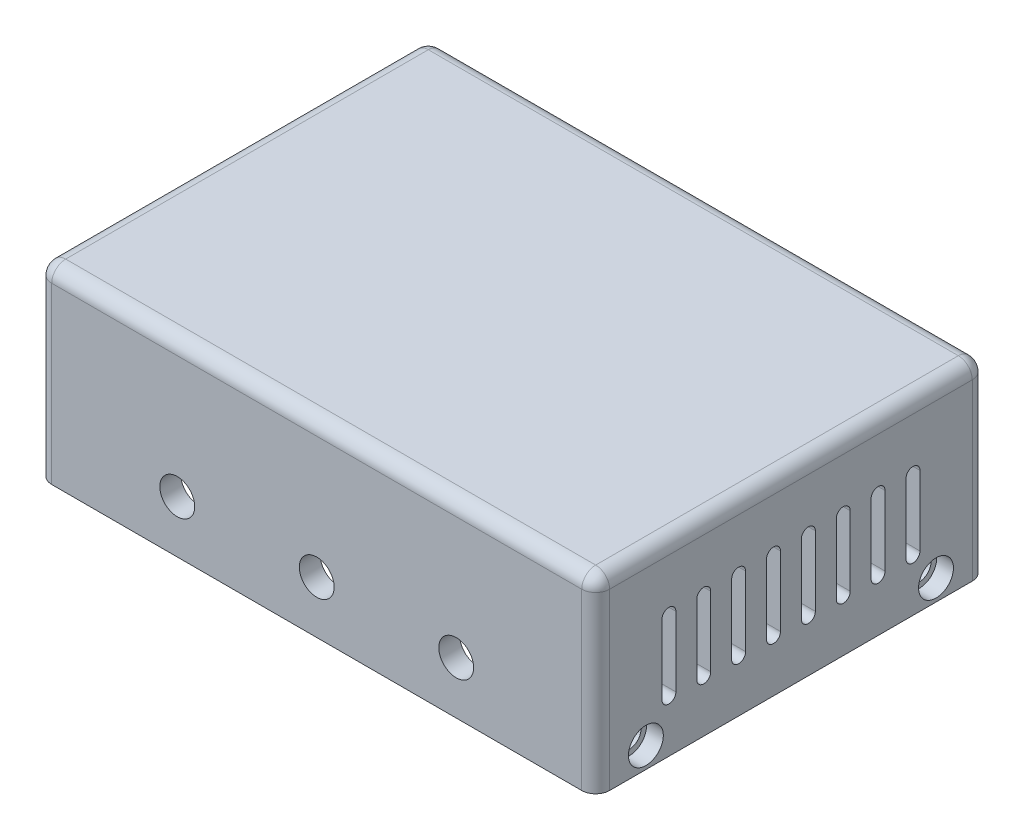
from build123d import *

# Parameters (mm, degrees)
SKETCH1_W                                    = 80
SKETCH1_H                                    = 56
BOSS_EXTRUDE1_DEPTH                          = 3
SKETCH2_W                                    = 74
SKETCH2_H                                    = 50
BOSS_EXTRUDE2_DEPTH                          = 24
FILLET1_R                                    = 1
FILLET2_R                                    = 2
SKETCH3_R                                    = 2.5
CUT_EXTRUDE1_DEPTH                           = 10
CUT_EXTRUDE2_DEPTH                           = 10
FILLET3_R                                    = 2
BOSS_EXTRUDE3_DEPTH                          = 2
CUT_EXTRUDE3_DEPTH                           = 89.090862182
CBORE_FOR_M3_CROSS_RECESS_PAN_HEAD_S_2_COUNT = 2
CBORE_FOR_M3_CROSS_RECESS_PAN_HEAD_S_2_PITCH = 15.207328374
CBORE_FOR_M3_CROSS_RECESS_PAN_HEAD_S_3_COUNT = 2
CBORE_FOR_M3_CROSS_RECESS_PAN_HEAD_S_3_PITCH = 14.900401376


with BuildPart() as part:
    # Sketch1 → Boss-Extrude1 (new body)
    with BuildSketch(Plane(origin=(0, 0, 0), x_dir=(1, 0, 0), z_dir=(0, 1, 0))):
        Rectangle(SKETCH1_W, SKETCH1_H)
    extrude(amount=BOSS_EXTRUDE1_DEPTH)

    # Sketch2 → Boss-Extrude2 (add)
    with BuildSketch(Plane.XZ):
        Polygon((37, -28), (-37, -28), (-40, -28), (-40, 28), (40, 28), (40, -28), align=None)
        Rectangle(SKETCH2_W, SKETCH2_H, mode=Mode.SUBTRACT)
    extrude(amount=BOSS_EXTRUDE2_DEPTH)

    # Fillet1
    fillet1_edges = [part.edges().sort_by_distance(p)[0] for p in [
        (-37, -12, -25),
        (37, -12, -25),
        (37, -12, 25),
        (-37, -12, 25),
    ]]
    fillet(fillet1_edges, radius=FILLET1_R)

    # Fillet2
    fillet2_edges = [part.edges().sort_by_distance(p)[0] for p in [
        (-40, 3, 0),
        (0, 3, 28),
        (40, 3, 0),
        (40, -10.5, 28),
        (-40, -10.5, 28),
        (-40, -10.5, -28),
        (40, -10.5, -28),
        (0, 3, -28),
    ]]
    fillet(fillet2_edges, radius=FILLET2_R)

    # Sketch3 → Cut-Extrude1 (cut)
    with BuildSketch(Plane.XY.offset(28)):
        with Locations((0, -16.5)):
            Circle(SKETCH3_R)
        with Locations((-20, -16.5)):
            Circle(SKETCH3_R)
        with Locations(Location((20, -16.5, 0), (0, 0, 180))):
            Circle(SKETCH3_R)
    extrude(amount=-CUT_EXTRUDE1_DEPTH, mode=Mode.SUBTRACT)

    # Sketch5 → Cut-Extrude2 (cut)
    with BuildSketch(Plane(origin=(0, 0, -28), x_dir=(-1, 0, 0), z_dir=(0, 0, -1))):
        with BuildLine():
            Line((-27, -1), (-23, -1))
            ThreePointArc((-23, -1), (-20, -4), (-23, -7))
            Line((-23, -7), (-27, -7))
            ThreePointArc((-27, -7), (-30, -4), (-27, -1))
        make_face()
    extrude(amount=-CUT_EXTRUDE2_DEPTH, mode=Mode.SUBTRACT)

    # Fillet3
    fillet3_edges = [part.edges().sort_by_distance(p)[0] for p in [
        (30, -4, -28),
        (25, -7, -28),
        (20, -4, -28),
        (25, -1, -28),
    ]]
    fillet(fillet3_edges, radius=FILLET3_R - 0.0001)  # a hair under: the kernel refuses the full size

    # Sketch6 → Boss-Extrude3 (add)
    with BuildSketch(Plane.XZ):
        with BuildLine():
            Line((37, 18.5), (33, 18.5))
            ThreePointArc((33, 18.5), (31.232233047, 19.232233047), (30.5, 21))
            Line((30.5, 21), (30.5, 25))
            Line((30.5, 25), (37, 25))
            Line((37, 25), (37, 18.5))
        make_face()
        with BuildLine():
            Line((37, -5), (30.5, -5))
            Line((30.5, -5), (30.5, -1))
            ThreePointArc((30.5, -1), (31.232233047, 0.767766953), (33, 1.5))
            Line((33, 1.5), (37, 1.5))
            Line((37, 1.5), (37, -5))
        make_face()
        with BuildLine():
            Line((-29, 1.5), (-25, 1.5))
            ThreePointArc((-25, 1.5), (-23.232233047, 0.767766953), (-22.5, -1))
            Line((-22.5, -1), (-22.5, -5))
            Line((-22.5, -5), (-29, -5))
            Line((-29, -5), (-29, 1.5))
        make_face()
        with BuildLine():
            Line((-29, 25), (-22.5, 25))
            Line((-22.5, 25), (-22.5, 21))
            ThreePointArc((-22.5, 21), (-23.232233047, 19.232233047), (-25, 18.5))
            Line((-25, 18.5), (-29, 18.5))
            Line((-29, 18.5), (-29, 25))
        make_face()
    extrude(amount=BOSS_EXTRUDE3_DEPTH)

    # Sketch7 → Cut-Extrude3 (cut, through all)
    with BuildSketch(Plane.ZY.offset(40)):
        with BuildLine():
            Line((-16.5, -6.5), (-16.5, -16.5))
            ThreePointArc((-16.5, -16.5), (-17.5, -17.5), (-18.5, -16.5))
            Line((-18.5, -16.5), (-18.5, -6.5))
            ThreePointArc((-18.5, -6.5), (-17.5, -5.5), (-16.5, -6.5))
        make_face()
        with BuildLine():
            Line((-11.5, -6.5), (-11.5, -16.5))
            ThreePointArc((-11.5, -16.5), (-12.5, -17.5), (-13.5, -16.5))
            Line((-13.5, -16.5), (-13.5, -6.5))
            ThreePointArc((-13.5, -6.5), (-12.5, -5.5), (-11.5, -6.5))
        make_face()
        with BuildLine():
            Line((-6.5, -6.5), (-6.5, -16.5))
            ThreePointArc((-6.5, -16.5), (-7.5, -17.5), (-8.5, -16.5))
            Line((-8.5, -16.5), (-8.5, -6.5))
            ThreePointArc((-8.5, -6.5), (-7.5, -5.5), (-6.5, -6.5))
        make_face()
        with BuildLine():
            Line((-1.5, -6.5), (-1.5, -16.5))
            ThreePointArc((-1.5, -16.5), (-2.5, -17.5), (-3.5, -16.5))
            Line((-3.5, -16.5), (-3.5, -6.5))
            ThreePointArc((-3.5, -6.5), (-2.5, -5.5), (-1.5, -6.5))
        make_face()
        with BuildLine():
            Line((3.5, -6.5), (3.5, -16.5))
            ThreePointArc((3.5, -16.5), (2.5, -17.5), (1.5, -16.5))
            Line((1.5, -16.5), (1.5, -6.5))
            ThreePointArc((1.5, -6.5), (2.5, -5.5), (3.5, -6.5))
        make_face()
        with BuildLine():
            Line((8.5, -6.5), (8.5, -16.5))
            ThreePointArc((8.5, -16.5), (7.5, -17.5), (6.5, -16.5))
            Line((6.5, -16.5), (6.5, -6.5))
            ThreePointArc((6.5, -6.5), (7.5, -5.5), (8.5, -6.5))
        make_face()
        with BuildLine():
            Line((13.5, -6.5), (13.5, -16.5))
            ThreePointArc((13.5, -16.5), (12.5, -17.5), (11.5, -16.5))
            Line((11.5, -16.5), (11.5, -6.5))
            ThreePointArc((11.5, -6.5), (12.5, -5.5), (13.5, -6.5))
        make_face()
        with BuildLine():
            Line((18.5, -6.5), (18.5, -16.5))
            ThreePointArc((18.5, -16.5), (17.5, -17.5), (16.5, -16.5))
            Line((16.5, -16.5), (16.5, -6.5))
            ThreePointArc((16.5, -6.5), (17.5, -5.5), (18.5, -6.5))
        make_face()
    extrude(amount=-CUT_EXTRUDE3_DEPTH, mode=Mode.SUBTRACT)

    # Sketch9 → CBORE for M3 Cross Recess Pan Head Screw1 (revolve, cut)
    with BuildSketch(Plane(origin=(40, -21, -20.8), x_dir=(0, 0, -1), z_dir=(0, 1, 0))):
        Polygon((0, 0), (0, 3), (1.7, 3), (1.7, 2.4), (2.5, 2.4), (2.5, 0), align=None)
    cbore_for_m3_cross_recess_pan_head_screw = revolve(axis=Axis((46.35, -21, -20.8), (-1, 0, 0)), mode=Mode.SUBTRACT)

    # CBORE for M3 Cross Recess Pan Head S 2: CBORE for M3 Cross Recess Pan Head Screw1 ×2
    with Locations(*[Vector(0, -0.1073379095741248, -0.9942225973936909) * (i * CBORE_FOR_M3_CROSS_RECESS_PAN_HEAD_S_2_PITCH) for i in range(1, CBORE_FOR_M3_CROSS_RECESS_PAN_HEAD_S_2_COUNT)]):
        add(cbore_for_m3_cross_recess_pan_head_screw, mode=Mode.SUBTRACT)

    # CBORE for M3 Cross Recess Pan Head S 3: CBORE for M3 Cross Recess Pan Head Screw1 ×2
    with Locations(*[Vector(0, -0.0825685481728506, -0.9965853876375209) * (i * CBORE_FOR_M3_CROSS_RECESS_PAN_HEAD_S_3_PITCH) for i in range(1, CBORE_FOR_M3_CROSS_RECESS_PAN_HEAD_S_3_COUNT)]):
        add(cbore_for_m3_cross_recess_pan_head_screw, mode=Mode.SUBTRACT)

    # Mirror1: CBORE for M3 Cross Recess Pan Head Screw1 across plane
    add(cbore_for_m3_cross_recess_pan_head_screw.mirror(Plane.XY), mode=Mode.SUBTRACT)

    # Mirror1 copy 1 sketch → Mirror1 copy 1 (revolve, cut)
    with BuildSketch(Plane(origin=(40, -22.632322838, 35.919469515), x_dir=(0, 0, 1), z_dir=(0, 1, 0))):
        Polygon((0, 0), (0, -3), (1.7, -3), (1.7, -2.4), (2.5, -2.4), (2.5, 0), align=None)
    revolve(axis=Axis((46.35, -22.632322838, 35.919469515), (1, 0, 0)), mode=Mode.SUBTRACT)

    # Mirror1 copy 2 sketch → Mirror1 copy 2 (revolve, cut)
    with BuildSketch(Plane(origin=(40, -22.230304509, 35.649522281), x_dir=(0, 0, 1), z_dir=(0, 1, 0))):
        Polygon((0, 0), (0, -3), (1.7, -3), (1.7, -2.4), (2.5, -2.4), (2.5, 0), align=None)
    revolve(axis=Axis((46.35, -22.230304509, 35.649522281), (1, 0, 0)), mode=Mode.SUBTRACT)

    # Mirror2: CBORE for M3 Cross Recess Pan Head Screw1 across plane
    add(cbore_for_m3_cross_recess_pan_head_screw.mirror(Plane(origin=(0, 0, 0), x_dir=(0, 0, 1), z_dir=(1, 0, 0))), mode=Mode.SUBTRACT)

    # Mirror2 copy 1 sketch → Mirror2 copy 1 (revolve, cut)
    with BuildSketch(Plane(origin=(-40, -22.632322838, -35.919469515), x_dir=(0, 0, -1), z_dir=(0, 1, 0))):
        Polygon((0, 0), (0, -3), (1.7, -3), (1.7, -2.4), (2.5, -2.4), (2.5, 0), align=None)
    revolve(axis=Axis((-46.35, -22.632322838, -35.919469515), (-1, 0, 0)), mode=Mode.SUBTRACT)

    # Mirror2 copy 2 sketch → Mirror2 copy 2 (revolve, cut)
    with BuildSketch(Plane(origin=(-40, -22.230304509, -35.649522281), x_dir=(0, 0, -1), z_dir=(0, 1, 0))):
        Polygon((0, 0), (0, -3), (1.7, -3), (1.7, -2.4), (2.5, -2.4), (2.5, 0), align=None)
    revolve(axis=Axis((-46.35, -22.230304509, -35.649522281), (-1, 0, 0)), mode=Mode.SUBTRACT)

    # Mirror2 copy 3 sketch → Mirror2 copy 3 (revolve, cut)
    with BuildSketch(Plane(origin=(-40, -21, 20.8), x_dir=(0, 0, 1), z_dir=(0, 1, 0))):
        Polygon((0, 0), (0, 3), (1.7, 3), (1.7, 2.4), (2.5, 2.4), (2.5, 0), align=None)
    revolve(axis=Axis((-46.35, -21, 20.8), (1, 0, 0)), mode=Mode.SUBTRACT)

    # Mirror2 copy 4 sketch → Mirror2 copy 4 (revolve, cut)
    with BuildSketch(Plane(origin=(-40, -22.632322838, 35.919469515), x_dir=(0, 0, 1), z_dir=(0, 1, 0))):
        Polygon((0, 0), (0, 3), (1.7, 3), (1.7, 2.4), (2.5, 2.4), (2.5, 0), align=None)
    revolve(axis=Axis((-46.35, -22.632322838, 35.919469515), (1, 0, 0)), mode=Mode.SUBTRACT)

    # Mirror2 copy 5 sketch → Mirror2 copy 5 (revolve, cut)
    with BuildSketch(Plane(origin=(-40, -22.230304509, 35.649522281), x_dir=(0, 0, 1), z_dir=(0, 1, 0))):
        Polygon((0, 0), (0, 3), (1.7, 3), (1.7, 2.4), (2.5, 2.4), (2.5, 0), align=None)
    revolve(axis=Axis((-46.35, -22.230304509, 35.649522281), (1, 0, 0)), mode=Mode.SUBTRACT)


solid = part.part
